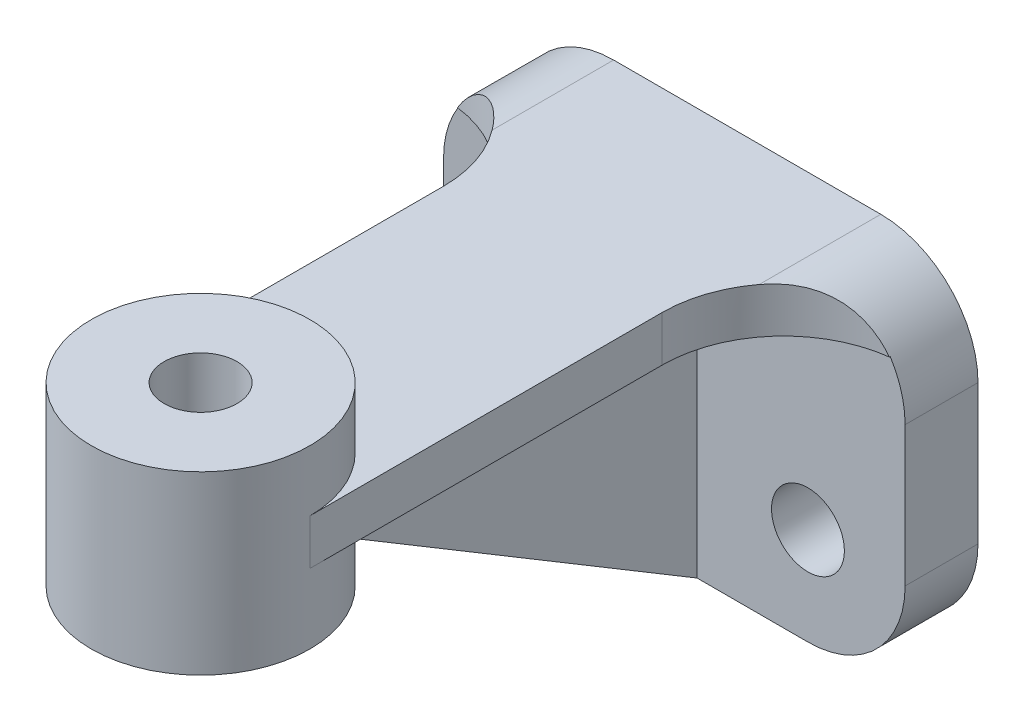
from build123d import *
from build123d.topology import SkipClean

# Parameters (mm, degrees)
SKETCH2_W                = 76
SKETCH2_H                = 12
BOSS_EXTRUDE1_DEPTH      = 55
BOSS_EXTRUDE2_DEPTH      = 7.5
BOSS_EXTRUDE3_DEPTH      = 10
BOSS_EXTRUDE3_DEPTH_BACK = 19
FILLET1_R                = 16
F_12_0MM_DOWEL_HOLE1_D   = 12
RIB1_START               = -3.75
RIB1_DEPTH               = 7.5
FILLET2_START            = 6
FILLET2_DEPTH            = 0.149958722
FILLET2_START_2          = 6.149958722
FILLET2_2_DEPTH          = 19.850041378
FILLET2_START_3          = -7.500000001
FILLET2_3_DEPTH          = 8.500000001


with BuildPart() as part:
    # Sketch2 → Boss-Extrude1 (new body)
    with BuildSketch(Plane(origin=(0, 0, 0), x_dir=(1, 0, 0), z_dir=(0, 1, 0))):
        Rectangle(SKETCH2_W, SKETCH2_H)
    extrude(amount=-BOSS_EXTRUDE1_DEPTH)

    # Sketch2<3> → Boss-Extrude2 (add)
    with BuildSketch(Plane(origin=(0, 0, 0), x_dir=(1, 0, 0), z_dir=(0, 1, 0))):
        with BuildLine():
            Line((18, -6), (-18, -6))
            Line((-18, -6), (-18, -84))
            ThreePointArc((-18, -84), (0, -66), (18, -84))
            Line((18, -84), (18, -6))
        make_face()
    extrude(amount=-BOSS_EXTRUDE2_DEPTH)

    # Sketch2<4> → Boss-Extrude3 (add, two sides: drawn at the far end of the back side and taken through both)
    with BuildSketch(Plane(origin=(0, 0, 0), x_dir=(1, 0, 0), z_dir=(0, 1, 0)).offset(-BOSS_EXTRUDE3_DEPTH_BACK)):
        with BuildLine():
            ThreePointArc((18, -84), (0, -66), (-18, -84))
            Line((-18, -84), (-6, -84))
            ThreePointArc((-6, -84), (0, -78), (6, -84))
            Line((6, -84), (18, -84))
        make_face()
        with BuildLine():
            Line((-6, -84), (-18, -84))
            ThreePointArc((-18, -84), (0, -102), (18, -84))
            Line((18, -84), (6, -84))
            ThreePointArc((6, -84), (0, -90), (-6, -84))
        make_face()
    extrude(amount=BOSS_EXTRUDE3_DEPTH + BOSS_EXTRUDE3_DEPTH_BACK)

    # Fillet1
    fillet1_edges = [part.edges().sort_by_distance(p)[0] for p in [
        (38, -55, 0),
        (-38, -55, 0),
        (-38, 0, 0),
        (38, 0, 0),
    ]]
    fillet(fillet1_edges, radius=FILLET1_R)

    # Ø12.0mm Dowel Hole1 (through all)
    with Locations(Plane.XY.offset(6)):
        with Locations((-22, -39), (22, -39)):
            Hole(F_12_0MM_DOWEL_HOLE1_D / 2)

    # Rib1: read off the stored shape, not the designer's step
    # Rib1 outline → Rib1 (add)
    with SkipClean():  # the faces are left unmerged after this step: merging them gives an invalid solid
        with BuildSketch(Plane.ZY.offset(RIB1_START)):
            Polygon((6, -55), (66.394958109, -18.763025135), (68, -17.8), (68, -7.5), (6, -7.5), align=None)
        extrude(amount=RIB1_DEPTH)

    # Fillet2: read off the stored shape, not the designer's step
    # Fillet2 outline → Fillet2 (add)
    with SkipClean():  # the faces are left unmerged after this step: merging them gives an invalid solid
        with BuildSketch(Plane.XY.offset(FILLET2_START)):
            with BuildLine():
                Line((-18, -7.5), (-18, 0))
                Line((-18, 0), (-22, 0))
                ThreePointArc((-22, 0), (-29.745966692, -2), (-35.555441712, -7.5))
                Line((-35.555441712, -7.5), (-18, -7.5))
            make_face()
            with BuildLine():
                Line((18, -7.5), (35.555441712, -7.5))
                ThreePointArc((35.555441712, -7.5), (29.745966692, -2), (22, 0))
                Line((22, 0), (18, 0))
                Line((18, 0), (18, -7.5))
            make_face()
        extrude(amount=FILLET2_DEPTH)

    # Fillet2 2 outline → Fillet2 2 (add)
    with SkipClean():  # the faces are left unmerged after this step: merging them gives an invalid solid
        with BuildSketch(Plane.XY.offset(FILLET2_START_2)):
            with BuildLine():
                Line((-18, -7.5), (-18, 0))
                Line((-18, 0), (-22, 0))
                ThreePointArc((-22, 0), (-29.745966693, -2), (-35.555441712, -7.500000001))
                Line((-35.555441712, -7.500000001), (-18, -7.5))
            make_face()
            with BuildLine():
                Line((18, -7.5), (35.555441712, -7.5))
                ThreePointArc((35.555441712, -7.5), (29.745966692, -2), (22, 0))
                Line((22, 0), (18, 0))
                Line((18, 0), (18, -7.5))
            make_face()
        extrude(amount=FILLET2_2_DEPTH)

    # Fillet2 3 outline → Fillet2 3 (cut)
    with SkipClean():  # the faces are left unmerged after this step: merging them gives an invalid solid
        with BuildSketch(Plane(origin=(0, 0, 0), x_dir=(1, 0, 0), z_dir=(0, 1, 0)).offset(FILLET2_START_3)):
            with BuildLine():
                Line((37, -5.972059597), (35.555441712, -6.149958822))
                ThreePointArc((35.555441712, -6.149958822), (23.018491969, -12.750305018), (18, -26))
                Line((18, -26), (37, -26.0000001))
                Line((37, -26.0000001), (37, -5.972059597))
            make_face()
            with BuildLine():
                Line((-35.555441712, -6.149958822), (-37, -5.972059597))
                Line((-37, -5.972059597), (-37, -26.0000001))
                Line((-37, -26.0000001), (-18, -26))
                ThreePointArc((-18, -26), (-23.018491969, -12.750305018), (-35.555441712, -6.149958822))
            make_face()
        extrude(amount=FILLET2_3_DEPTH, mode=Mode.SUBTRACT)


solid = part.part
